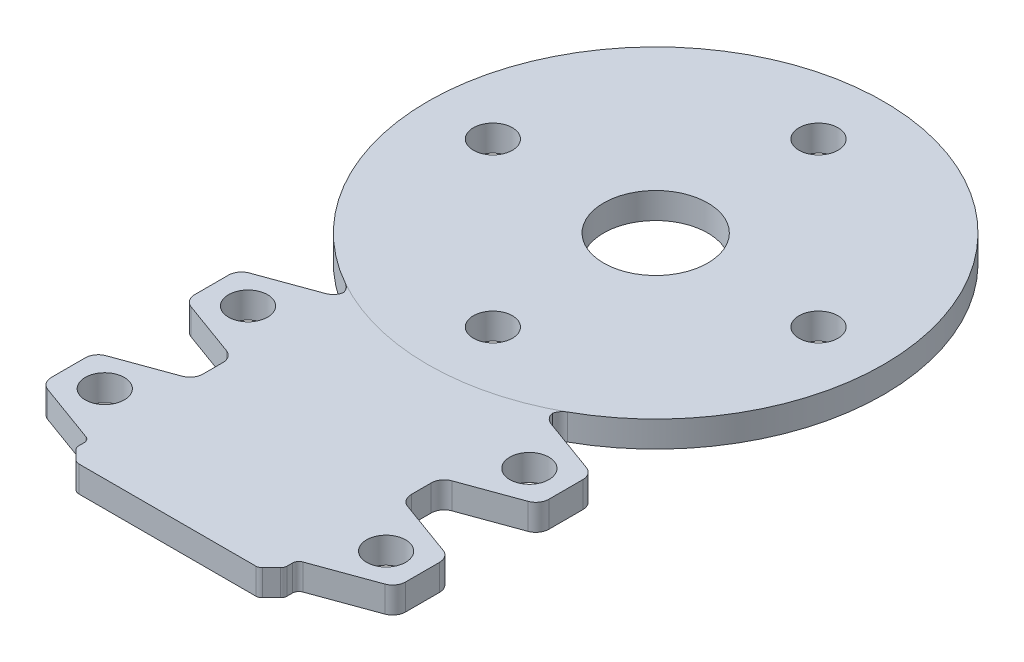
from build123d import *

# Parameters (mm, degrees)
SKETCH1_R           = 17.5
SKETCH1_R_2         = 1.5
SKETCH1_R_3         = 4
BOSS_EXTRUDE1_DEPTH = 2
BOSS_EXTRUDE2_DEPTH = 2
SKETCH3_R           = 1.5
BOSS_EXTRUDE4_DEPTH = 2
FILLET1_R           = 1
CHAMFER1_SIZE       = 1
FILLET2_R           = 0.5


with BuildPart() as part:
    # Sketch1 → Boss-Extrude1 (new body)
    with BuildSketch(Plane(origin=(0, 0, 0), x_dir=(1, 0, 0), z_dir=(0, 1, 0))):
        with Locations(Location((0, 0, 0), (0, 0, 270))):
            Circle(SKETCH1_R)
        with Locations(Location((-12.5, 0, 0), (0, 0, 270))):
            Circle(SKETCH1_R_2, mode=Mode.SUBTRACT)
        with Locations(Location((0, -12.5, 0), (0, 0, 270))):
            Circle(SKETCH1_R_2, mode=Mode.SUBTRACT)
        with Locations(Location((12.5, 0, 0), (0, 0, 270))):
            Circle(SKETCH1_R_2, mode=Mode.SUBTRACT)
        with Locations(Location((0, 12.5, 0), (0, 0, 270))):
            Circle(SKETCH1_R_2, mode=Mode.SUBTRACT)
        with Locations(Location((0, 0, 0), (0, 0, 270))):
            Circle(SKETCH1_R_3, mode=Mode.SUBTRACT)
    extrude(amount=BOSS_EXTRUDE1_DEPTH)

    # Sketch2 → Boss-Extrude2 (add)
    with BuildSketch(Plane(origin=(0, 0, 0), x_dir=(1, 0, 0), z_dir=(0, 1, 0))):
        with BuildLine():
            Line((-8, -37.5), (8, -37.5))
            Line((8, -37.5), (8, -15.564382416))
            ThreePointArc((8, -15.564382416), (0, -17.5), (-8, -15.564382416))
            Line((-8, -15.564382416), (-8, -37.5))
        make_face()
    extrude(amount=BOSS_EXTRUDE2_DEPTH)

    # Sketch3 → Boss-Extrude4 (add)
    # profile 1 of 2: a face of its own
    with BuildSketch(Plane(origin=(0, 0, 0), x_dir=(1, 0, 0), z_dir=(0, 1, 0))):
        Polygon((-13.6, -18.5), (-13.6, -22.5), (-8, -24.538233312), (-8, -16.461766688), align=None)
        with Locations(Location((-10.8, -20.5, 0), (0, 0, 270))):
            Circle(SKETCH3_R, mode=Mode.SUBTRACT)
    # profile 2 of 2: a face of its own
    with BuildSketch(Plane(origin=(0, 0, 0), x_dir=(1, 0, 0), z_dir=(0, 1, 0))):
        Polygon((-13.6, -29.5), (-13.6, -33.5), (-8, -35.538233312), (-8, -27.461766688), align=None)
        with Locations(Location((-10.8, -31.5, 0), (0, 0, 270))):
            Circle(SKETCH3_R, mode=Mode.SUBTRACT)
    boss_extrude4 = extrude(amount=BOSS_EXTRUDE4_DEPTH)

    # Mirror1: Boss-Extrude4 across plane
    add(boss_extrude4.mirror(Plane(origin=(0, 0, 0), x_dir=(0, 0, 1), z_dir=(1, 0, 0))))

    # Fillet1
    # the kernel refuses this fillet: 1 mm, written as the material it adds along each edge
    with BuildSketch(Plane(origin=(8, 0, 15.564382416), x_dir=(0.8816627769698464, 0, -0.4718800140987312), z_dir=(0, 1, 0))) as fillet1_piece_1:
        with BuildLine():
            CenterArc((0.59907863, -0.999861528), FILLET1_R, 90.953507264, 60.89009106)
            Line((-0.282584147, -0.527981514), (0, 0))
            ThreePointArc((0, 0), (0.291218778, -0.002423264), (0.582437557, 0))
        make_face()
    extrude(amount=2)
    with BuildSketch(Plane(origin=(-8, 0, 15.564382416), x_dir=(-0.8816627769698451, 0, -0.4718800140987337), z_dir=(0, 1, 0))) as fillet1_piece_2:
        with BuildLine():
            CenterArc((0.59907863, 0.999861528), FILLET1_R, 208.156401676, 60.89009106)
            Line((-0.282584147, 0.527981514), (0, 0))
            ThreePointArc((0, 0), (0.291218778, 0.002423264), (0.582437557, 0))
        make_face()
    extrude(amount=2)
    with BuildSketch(Plane(origin=(-8, 0, 24.538233312), x_dir=(-0.9396926207859061, 0, -0.342020143325675), z_dir=(0, 1, 0)), Plane(origin=(-8, 0, 16.461766688), x_dir=(0, 0, -1), z_dir=(0, 1, 0)), Plane(origin=(-8, 0, 27.461766688), x_dir=(0, 0, -1), z_dir=(0, 1, 0)), Plane(origin=(8, 0, 24.538233312), x_dir=(0, 0, 1), z_dir=(0, 1, 0))) as fillet1_piece_3:
        with BuildLine():
            CenterArc((FILLET1_R * 0.70020753821, FILLET1_R), FILLET1_R, 200, 70)
            Line((-FILLET1_R * 0.239485082576, FILLET1_R * 0.657979856674), (0, 0))
            Line((0, 0), (FILLET1_R * 0.70020753821, 0))
        make_face()
    extrude(amount=2)
    with BuildSketch(Plane(origin=(8, 0, 16.461766688), x_dir=(0, 0, -1), z_dir=(0, 1, 0)), Plane(origin=(8, 0, 27.461766688), x_dir=(0, 0, -1), z_dir=(0, 1, 0))) as fillet1_piece_4:
        with BuildLine():
            CenterArc((FILLET1_R * 0.70020753821, -FILLET1_R), FILLET1_R, 90, 70)
            Line((-FILLET1_R * 0.239485082576, -FILLET1_R * 0.657979856674), (0, 0))
            Line((0, 0), (FILLET1_R * 0.70020753821, 0))
        make_face()
    extrude(amount=2)
    # the kernel refuses this fillet: 1 mm, written as the material it takes off along each edge
    with BuildSketch(Plane(origin=(-13.6, -1.750518846, 22.5), x_dir=(0, 0, -1), z_dir=(0, 1, 0)), Plane(origin=(-13.6, -1.750518846, 18.5), x_dir=(0.9396926207859061, 0, -0.342020143325675), z_dir=(0, 1, 0)), Plane(origin=(-13.6, -1.750518846, 33.5), x_dir=(0, 0, -1), z_dir=(0, 1, 0)), Plane(origin=(-13.6, -1.750518846, 29.5), x_dir=(0.9396926207859078, 0, -0.3420201433256705), z_dir=(0, 1, 0)), Plane(origin=(13.6, -1.750518846, 18.5), x_dir=(0, 0, 1), z_dir=(0, 1, 0)), Plane(origin=(13.6, -1.750518846, 22.5), x_dir=(-0.9396926207859078, 0, 0.3420201433256705), z_dir=(0, 1, 0)), Plane(origin=(13.6, -1.750518846, 29.5), x_dir=(0, 0, 1), z_dir=(0, 1, 0)), Plane(origin=(13.6, -1.750518846, 33.5), x_dir=(-0.9396926207859061, 0, 0.342020143325675), z_dir=(0, 1, 0))) as fillet1_2_piece_1:
        with BuildLine():
            CenterArc((FILLET1_R * 0.70020753821, -FILLET1_R), FILLET1_R, 90, 70)
            Line((-FILLET1_R * 0.239485082576, -FILLET1_R * 0.657979856674), (0, 0))
            Line((0, 0), (FILLET1_R * 0.70020753821, 0))
        make_face()
    extrude(amount=5.501037691, mode=Mode.SUBTRACT)

    # Chamfer1
    chamfer1_edges = [part.edges().sort_by_distance(p)[0] for p in [
        (-8, 1, 37.5),
        (8, 1, 37.5),
    ]]
    chamfer(chamfer1_edges, length=CHAMFER1_SIZE)

    # Fillet2
    fillet2_edges = [part.edges().sort_by_distance(p)[0] for p in [
        (7, 1, 37.5),
        (-7, 1, 37.5),
        (-8, 1, 36.5),
        (8, 1, 36.5),
        (-8, 1, 35.538233312),
        (8, 1, 35.538233312),
    ]]
    fillet(fillet2_edges, radius=FILLET2_R)


solid = part.part
